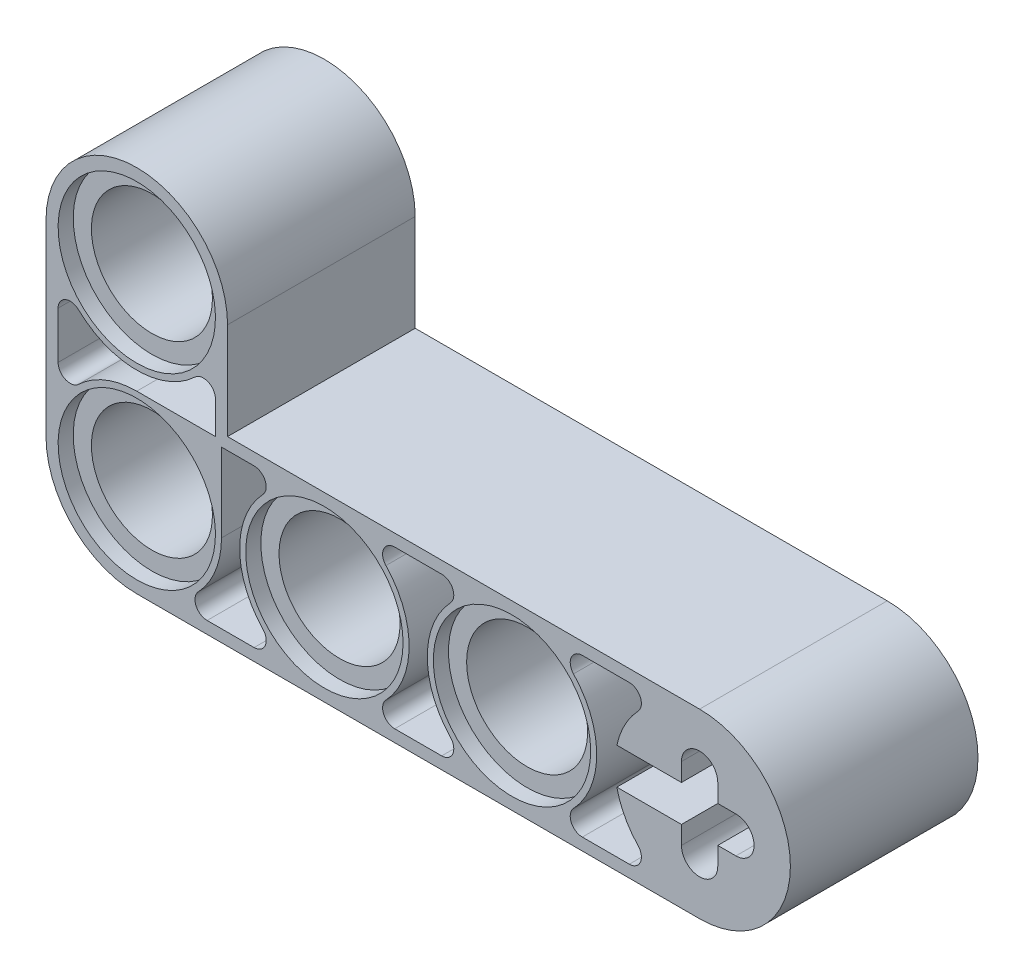
from build123d import *
from build123d.topology import SkipClean

# Parameters (mm, degrees)
LTEMPLATE_START              = -6.034740769
LTEMPLATE_OUTLINE_R          = 2.54
LTEMPLATE_DEPTH              = 6.35
LTEMPLATE_START_2            = -6.669740769
LTEMPLATE_2_OUTLINE_R        = 3.302
LTEMPLATE_2_DEPTH            = 7.62
TWOSTRAIGHT_START            = 0.352935157
TWOSTRAIGHT_OUTLINE_R        = 2.54
TWOSTRAIGHT_DEPTH            = 6.604
TWOSTRAIGHT_START_2          = -0.282064843
TWOSTRAIGHT_2_OUTLINE_R      = 3.302
TWOSTRAIGHT_2_DEPTH          = 7.874
BOSS_EXTRUDE1_DEPTH          = 7.874
BODY_MOVE_COPY18_START       = 1.204259231
BODY_MOVE_COPY18_OUTLINE_R   = 2.54
BODY_MOVE_COPY18_DEPTH       = 6.387675926
BODY_MOVE_COPY18_START_2     = -0.282064843
BODY_MOVE_COPY18_2_OUTLINE_R = 2.54
BODY_MOVE_COPY18_2_DEPTH     = 1.486324074
BODY_MOVE_COPY18_START_3     = 0.569259231
BODY_MOVE_COPY18_3_DEPTH     = 0.635
BODY_MOVE_COPY18_START_4     = -6.034740769
BODY_MOVE_COPY18_4_OUTLINE_R = 2.54
BODY_MOVE_COPY18_4_DEPTH     = 6.604
BODY_MOVE_COPY18_START_5     = -6.669740769
BODY_MOVE_COPY18_5_OUTLINE_R = 3.302
BODY_MOVE_COPY18_5_DEPTH     = 7.874
CUT_EXTRUDE3_DEPTH           = 7.874
CUT_EXTRUDE5_DEPTH           = 7.874
BOSS_EXTRUDE3_DEPTH          = 7.874


# Read off the part's stored shape, not the designer's step: LTemplate, TwoStraight, Body-Move/Copy18
with BuildPart() as part:
    # LTemplate outline → LTemplate (new body)
    with BuildSketch(Plane.XY.offset(LTEMPLATE_START)):
        with BuildLine():
            ThreePointArc((-0.233632913, 12.025918555), (-4.043632913, 8.215918555), (-0.233632913, 4.405918555))
            Line((-0.233632913, 4.405918555), (15.514367087, 4.405918555))
            ThreePointArc((15.514367087, 4.405918555), (19.324367087, 8.215918555), (15.514367087, 12.025918555))
            Line((15.514367087, 12.025918555), (-0.233632913, 12.025918555))
        make_face()
        with BuildLine():
            Line((4.689153777, 4.913918555), (2.717580397, 4.913918555))
            ThreePointArc((2.717580397, 4.913918555), (2.250952601, 5.221113923), (2.348678733, 5.771168555))
            ThreePointArc((2.348678733, 5.771168555), (3.322367087, 8.215918555), (2.348678733, 10.660668555))
            ThreePointArc((2.348678733, 10.660668555), (2.250952601, 11.210723186), (2.717580397, 11.517918555))
            Line((2.717580397, 11.517918555), (4.689153777, 11.517918555))
            ThreePointArc((4.689153777, 11.517918555), (5.155781573, 11.210723186), (5.058055441, 10.660668555))
            ThreePointArc((5.058055441, 10.660668555), (4.084367087, 8.215918555), (5.058055441, 5.771168555))
            ThreePointArc((5.058055441, 5.771168555), (5.155781573, 5.221113923), (4.689153777, 4.913918555))
        make_face(mode=Mode.SUBTRACT)
        with BuildLine():
            Line((12.040969327, 8.977918555), (14.752367087, 8.977918555))
            Line((14.752367087, 8.977918555), (14.752367087, 9.739918555))
            ThreePointArc((14.752367087, 9.739918555), (15.514367087, 10.501918555), (16.276367087, 9.739918555))
            Line((16.276367087, 9.739918555), (16.276367087, 8.977918555))
            Line((16.276367087, 8.977918555), (17.038367087, 8.977918555))
            ThreePointArc((17.038367087, 8.977918555), (17.800367087, 8.215918555), (17.038367087, 7.453918555))
            Line((17.038367087, 7.453918555), (16.276367087, 7.453918555))
            Line((16.276367087, 7.453918555), (16.276367087, 6.691918555))
            ThreePointArc((16.276367087, 6.691918555), (15.514367087, 5.929918555), (14.752367087, 6.691918555))
            Line((14.752367087, 6.691918555), (14.752367087, 7.453918555))
            Line((14.752367087, 7.453918555), (12.040969327, 7.453918555))
            ThreePointArc((12.040969327, 7.453918555), (12.371785983, 6.551791154), (12.932055441, 5.771168555))
            ThreePointArc((12.932055441, 5.771168555), (13.029781573, 5.221113923), (12.563153777, 4.913918555))
            Line((12.563153777, 4.913918555), (10.591580397, 4.913918555))
            ThreePointArc((10.591580397, 4.913918555), (10.124952601, 5.221113923), (10.222678733, 5.771168555))
            ThreePointArc((10.222678733, 5.771168555), (11.196367087, 8.215918555), (10.222678733, 10.660668555))
            ThreePointArc((10.222678733, 10.660668555), (10.124952601, 11.210723186), (10.591580397, 11.517918555))
            Line((10.591580397, 11.517918555), (12.563153777, 11.517918555))
            ThreePointArc((12.563153777, 11.517918555), (13.029781573, 11.210723186), (12.932055441, 10.660668555))
            ThreePointArc((12.932055441, 10.660668555), (12.371785983, 9.880045956), (12.040969327, 8.977918555))
        make_face(mode=Mode.SUBTRACT)
        with Locations((-0.233632913, 8.215918555)):
            Circle(LTEMPLATE_OUTLINE_R, mode=Mode.SUBTRACT)
        with Locations((7.640367087, 8.215918555)):
            Circle(LTEMPLATE_OUTLINE_R, mode=Mode.SUBTRACT)
    extrude(amount=LTEMPLATE_DEPTH)

    # LTemplate 2 outline → LTemplate 2 (add)
    with BuildSketch(Plane.XY.offset(LTEMPLATE_START_2)):
        with BuildLine():
            ThreePointArc((-0.233632913, 12.025918555), (-4.043632913, 8.215918555), (-0.233632913, 4.405918555))
            Line((-0.233632913, 4.405918555), (15.514367087, 4.405918555))
            ThreePointArc((15.514367087, 4.405918555), (19.324367087, 8.215918555), (15.514367087, 12.025918555))
            Line((15.514367087, 12.025918555), (-0.233632913, 12.025918555))
        make_face()
        with Locations((-0.233632913, 8.215918555)):
            Circle(LTEMPLATE_2_OUTLINE_R, mode=Mode.SUBTRACT)
        with BuildLine():
            Line((4.689153777, 4.913918555), (2.717580397, 4.913918555))
            ThreePointArc((2.717580397, 4.913918555), (2.250952601, 5.221113923), (2.348678733, 5.771168555))
            ThreePointArc((2.348678733, 5.771168555), (3.322367087, 8.215918555), (2.348678733, 10.660668555))
            ThreePointArc((2.348678733, 10.660668555), (2.250952601, 11.210723186), (2.717580397, 11.517918555))
            Line((2.717580397, 11.517918555), (4.689153777, 11.517918555))
            ThreePointArc((4.689153777, 11.517918555), (5.155781573, 11.210723186), (5.058055441, 10.660668555))
            ThreePointArc((5.058055441, 10.660668555), (4.084367087, 8.215918555), (5.058055441, 5.771168555))
            ThreePointArc((5.058055441, 5.771168555), (5.155781573, 5.221113923), (4.689153777, 4.913918555))
        make_face(mode=Mode.SUBTRACT)
        with Locations((7.640367087, 8.215918555)):
            Circle(LTEMPLATE_2_OUTLINE_R, mode=Mode.SUBTRACT)
        with BuildLine():
            Line((12.040969327, 8.977918555), (14.752367087, 8.977918555))
            Line((14.752367087, 8.977918555), (14.752367087, 9.739918555))
            ThreePointArc((14.752367087, 9.739918555), (15.514367087, 10.501918555), (16.276367087, 9.739918555))
            Line((16.276367087, 9.739918555), (16.276367087, 8.977918555))
            Line((16.276367087, 8.977918555), (17.038367087, 8.977918555))
            ThreePointArc((17.038367087, 8.977918555), (17.800367087, 8.215918555), (17.038367087, 7.453918555))
            Line((17.038367087, 7.453918555), (16.276367087, 7.453918555))
            Line((16.276367087, 7.453918555), (16.276367087, 6.691918555))
            ThreePointArc((16.276367087, 6.691918555), (15.514367087, 5.929918555), (14.752367087, 6.691918555))
            Line((14.752367087, 6.691918555), (14.752367087, 7.453918555))
            Line((14.752367087, 7.453918555), (12.040969327, 7.453918555))
            ThreePointArc((12.040969327, 7.453918555), (12.371785983, 6.551791154), (12.932055441, 5.771168555))
            ThreePointArc((12.932055441, 5.771168555), (13.029781573, 5.221113923), (12.563153777, 4.913918555))
            Line((12.563153777, 4.913918555), (10.591580397, 4.913918555))
            ThreePointArc((10.591580397, 4.913918555), (10.124952601, 5.221113923), (10.222678733, 5.771168555))
            ThreePointArc((10.222678733, 5.771168555), (11.196367087, 8.215918555), (10.222678733, 10.660668555))
            ThreePointArc((10.222678733, 10.660668555), (10.124952601, 11.210723186), (10.591580397, 11.517918555))
            Line((10.591580397, 11.517918555), (12.563153777, 11.517918555))
            ThreePointArc((12.563153777, 11.517918555), (13.029781573, 11.210723186), (12.932055441, 10.660668555))
            ThreePointArc((12.932055441, 10.660668555), (12.371785983, 9.880045956), (12.040969327, 8.977918555))
        make_face(mode=Mode.SUBTRACT)
    extrude(amount=LTEMPLATE_2_DEPTH)


with BuildPart() as body_2:
    # Body-Move/Copy15: copy of part
    add(part.part.moved(Location((0, 0, 0.254))))

    # Combine1: union part
    add(part.part)

    # Sketch1 → Boss-Extrude1 (add)
    with BuildSketch(Plane(origin=(0, 0, -6.669740769), x_dir=(-1, 0, 0), z_dir=(0, 0, -1))):
        with BuildLine():
            Line((8.107632913, 12.025918555), (0.233632913, 12.025918555))
            Line((0.233632913, 12.025918555), (0.233632913, 11.517918555))
            ThreePointArc((0.233632913, 11.517918555), (3.535632913, 8.215918555), (0.233632913, 4.913918555))
            Line((0.233632913, 4.913918555), (0.233632913, 4.405918555))
            Line((0.233632913, 4.405918555), (8.107632913, 4.405918555))
            ThreePointArc((8.107632913, 4.405918555), (4.297632913, 8.215918555), (8.107632913, 12.025918555))
        make_face()
    extrude(amount=-BOSS_EXTRUDE1_DEPTH)


with BuildPart() as body_2_2:
    # TwoStraight outline → TwoStraight (new body)
    with BuildSketch(Plane.XY.offset(TWOSTRAIGHT_START)):
        with BuildLine():
            ThreePointArc((-7.731255998, 20.304824752), (-11.541255998, 16.494824752), (-7.731255998, 12.684824752))
            Line((-7.731255998, 12.684824752), (0.142744002, 12.684824752))
            ThreePointArc((0.142744002, 12.684824752), (3.952744002, 16.494824752), (0.142744002, 20.304824752))
            Line((0.142744002, 20.304824752), (-7.731255998, 20.304824752))
        make_face()
        with BuildLine():
            Line((-4.780042688, 19.796824752), (-2.808469308, 19.796824752))
            ThreePointArc((-2.808469308, 19.796824752), (-2.341841512, 19.489629383), (-2.439567644, 18.939574752))
            ThreePointArc((-2.439567644, 18.939574752), (-3.413255998, 16.494824752), (-2.439567644, 14.050074752))
            ThreePointArc((-2.439567644, 14.050074752), (-2.341841512, 13.500020121), (-2.808469308, 13.192824752))
            Line((-2.808469308, 13.192824752), (-4.780042688, 13.192824752))
            ThreePointArc((-4.780042688, 13.192824752), (-5.246670484, 13.500020121), (-5.148944352, 14.050074752))
            ThreePointArc((-5.148944352, 14.050074752), (-4.175255998, 16.494824752), (-5.148944352, 18.939574752))
            ThreePointArc((-5.148944352, 18.939574752), (-5.246670484, 19.489629383), (-4.780042688, 19.796824752))
        make_face(mode=Mode.SUBTRACT)
        with Locations((-7.731255998, 16.494824752)):
            Circle(TWOSTRAIGHT_OUTLINE_R, mode=Mode.SUBTRACT)
        with Locations((0.142744002, 16.494824752)):
            Circle(TWOSTRAIGHT_OUTLINE_R, mode=Mode.SUBTRACT)
    extrude(amount=TWOSTRAIGHT_DEPTH)

    # TwoStraight 2 outline → TwoStraight 2 (add)
    with BuildSketch(Plane.XY.offset(TWOSTRAIGHT_START_2)):
        with BuildLine():
            ThreePointArc((-7.731255998, 20.304824752), (-11.541255998, 16.494824752), (-7.731255998, 12.684824752))
            Line((-7.731255998, 12.684824752), (0.142744002, 12.684824752))
            ThreePointArc((0.142744002, 12.684824752), (3.952744002, 16.494824752), (0.142744002, 20.304824752))
            Line((0.142744002, 20.304824752), (-7.731255998, 20.304824752))
        make_face()
        with Locations((-7.731255998, 16.494824752)):
            Circle(TWOSTRAIGHT_2_OUTLINE_R, mode=Mode.SUBTRACT)
        with BuildLine():
            Line((-4.780042688, 19.796824752), (-2.808469308, 19.796824752))
            ThreePointArc((-2.808469308, 19.796824752), (-2.341841512, 19.489629383), (-2.439567644, 18.939574752))
            ThreePointArc((-2.439567644, 18.939574752), (-3.413255998, 16.494824752), (-2.439567644, 14.050074752))
            ThreePointArc((-2.439567644, 14.050074752), (-2.341841512, 13.500020121), (-2.808469308, 13.192824752))
            Line((-2.808469308, 13.192824752), (-4.780042688, 13.192824752))
            ThreePointArc((-4.780042688, 13.192824752), (-5.246670484, 13.500020121), (-5.148944352, 14.050074752))
            ThreePointArc((-5.148944352, 14.050074752), (-4.175255998, 16.494824752), (-5.148944352, 18.939574752))
            ThreePointArc((-5.148944352, 18.939574752), (-5.246670484, 19.489629383), (-4.780042688, 19.796824752))
        make_face(mode=Mode.SUBTRACT)
        with Locations((0.142744002, 16.494824752)):
            Circle(TWOSTRAIGHT_2_OUTLINE_R, mode=Mode.SUBTRACT)
    extrude(amount=TWOSTRAIGHT_2_DEPTH)

    # Body-Move/Copy18 outline → Body-Move/Copy18 (cut)
    with BuildSketch(Plane.XY.offset(BODY_MOVE_COPY18_START)):
        with BuildLine():
            ThreePointArc((0.142744002, 12.684824752), (3.952744002, 16.494824752), (0.142744002, 20.304824752))
            Line((0.142744002, 20.304824752), (-7.731255998, 20.304824752))
            ThreePointArc((-7.731255998, 20.304824752), (-11.541255998, 16.494824752), (-7.731255998, 12.684824752))
            Line((-7.731255998, 12.684824752), (0.142744002, 12.684824752))
        make_face()
        with BuildLine():
            ThreePointArc((-5.148944352, 14.050074752), (-4.175255998, 16.494824752), (-5.148944352, 18.939574752))
            ThreePointArc((-5.148944352, 18.939574752), (-5.246670484, 19.489629383), (-4.780042688, 19.796824752))
            Line((-4.780042688, 19.796824752), (-2.808469308, 19.796824752))
            ThreePointArc((-2.808469308, 19.796824752), (-2.341841512, 19.489629383), (-2.439567644, 18.939574752))
            ThreePointArc((-2.439567644, 18.939574752), (-3.413255998, 16.494824752), (-2.439567644, 14.050074752))
            ThreePointArc((-2.439567644, 14.050074752), (-2.341841512, 13.500020121), (-2.808469308, 13.192824752))
            Line((-2.808469308, 13.192824752), (-4.780042688, 13.192824752))
            ThreePointArc((-4.780042688, 13.192824752), (-5.246670484, 13.500020121), (-5.148944352, 14.050074752))
        make_face(mode=Mode.SUBTRACT)
        with Locations((-7.731255998, 16.494824752)):
            Circle(BODY_MOVE_COPY18_OUTLINE_R, mode=Mode.SUBTRACT)
        with Locations((0.142744002, 16.494824752)):
            Circle(BODY_MOVE_COPY18_OUTLINE_R, mode=Mode.SUBTRACT)
    extrude(amount=BODY_MOVE_COPY18_DEPTH, mode=Mode.SUBTRACT)

    # Body-Move_Copy18 2 outline → Body-Move_Copy18 2 (cut)
    # profile 1 of 3: a face of its own
    with BuildSketch(Plane.XY.offset(BODY_MOVE_COPY18_START_2)):
        with BuildLine():
            Line((-7.082707456, 12.684824752), (-4.805632913, 12.684824752))
            Line((-4.805632913, 12.684824752), (-4.805632913, 13.138705245))
            ThreePointArc((-4.805632913, 13.138705245), (-4.806377911, 13.166207289), (-4.808610718, 13.193628668))
            ThreePointArc((-4.808610718, 13.193628668), (-5.12978155, 13.332386524), (-5.285064883, 13.645901329))
            ThreePointArc((-5.285064883, 13.645901329), (-5.4882484, 13.615751817), (-5.662882913, 13.507606909))
            ThreePointArc((-5.662882913, 13.507606909), (-6.324684634, 13.013194415), (-7.082707456, 12.684824752))
        make_face()
    # profile 2 of 3: a face of its own
    with BuildSketch(Plane.XY.offset(BODY_MOVE_COPY18_START_2)):
        with BuildLine():
            Line((-4.297632913, 13.192824752), (-4.297632913, 12.684824752))
            Line((-4.297632913, 12.684824752), (0.142744002, 12.684824752))
            ThreePointArc((0.142744002, 12.684824752), (3.952744002, 16.494824752), (0.142744002, 20.304824752))
            Line((0.142744002, 20.304824752), (-7.731255998, 20.304824752))
            ThreePointArc((-7.731255998, 20.304824752), (-9.379051287, 19.93006429), (-10.702684622, 18.879507526))
            ThreePointArc((-10.702684622, 18.879507526), (-6.586292552, 19.583000791), (-4.297632913, 16.089918555))
            Line((-4.297632913, 16.089918555), (-4.297632913, 15.569963406))
            ThreePointArc((-4.297632913, 15.569963406), (-4.283584635, 17.365857571), (-5.148944352, 18.939574752))
            ThreePointArc((-5.148944352, 18.939574752), (-5.246670484, 19.489629383), (-4.780042688, 19.796824752))
            Line((-4.780042688, 19.796824752), (-2.808469308, 19.796824752))
            ThreePointArc((-2.808469308, 19.796824752), (-2.341841512, 19.489629383), (-2.439567644, 18.939574752))
            ThreePointArc((-2.439567644, 18.939574752), (-3.413255998, 16.494824752), (-2.439567644, 14.050074752))
            ThreePointArc((-2.439567644, 14.050074752), (-2.341841512, 13.500020121), (-2.808469308, 13.192824752))
            Line((-2.808469308, 13.192824752), (-4.297632913, 13.192824752))
        make_face()
        with Locations((0.142744002, 16.494824752)):
            Circle(BODY_MOVE_COPY18_2_OUTLINE_R, mode=Mode.SUBTRACT)
    # profile 3 of 3: a face of its own
    with BuildSketch(Plane.XY.offset(BODY_MOVE_COPY18_START_2)):
        with BuildLine():
            ThreePointArc((-6.070097213, 14.573327551), (-9.460570174, 14.634428966), (-9.768791698, 18.011415756))
            ThreePointArc((-9.768791698, 18.011415756), (-9.836947089, 14.229522769), (-6.070097213, 14.573327551))
        make_face()
    extrude(amount=BODY_MOVE_COPY18_2_DEPTH, mode=Mode.SUBTRACT)

    # Body-Move_Copy18 3 outline → Body-Move_Copy18 3 (cut)
    with BuildSketch(Plane.XY.offset(BODY_MOVE_COPY18_START_3)):
        with BuildLine():
            ThreePointArc((-11.168403989, 14.85101403), (-10.325227262, 13.704231073), (-9.120001735, 12.946940132))
            ThreePointArc((-9.120001735, 12.946940132), (-5.859524484, 18.508433077), (-11.168403989, 14.85101403))
        make_face()
        with BuildLine():
            ThreePointArc((-9.768791698, 18.011415756), (-6.001941822, 18.355220538), (-6.070097213, 14.573327551))
            ThreePointArc((-6.070097213, 14.573327551), (-9.836947089, 14.229522769), (-9.768791698, 18.011415756))
        make_face(mode=Mode.SUBTRACT)
    extrude(amount=BODY_MOVE_COPY18_3_DEPTH, mode=Mode.SUBTRACT)

    # Body-Move_Copy18 4 outline → Body-Move_Copy18 4 (add)
    with SkipClean():  # the faces are left unmerged after this step: merging them gives an invalid solid
        with BuildSketch(Plane.XY.offset(BODY_MOVE_COPY18_START_4)):
            with BuildLine():
                Line((-4.297632913, 8.215918555), (-4.297632913, 16.089918555))
                ThreePointArc((-4.297632913, 16.089918555), (-8.107632913, 19.899918555), (-11.917632913, 16.089918555))
                Line((-11.917632913, 16.089918555), (-11.917632913, 8.215918555))
                ThreePointArc((-11.917632913, 8.215918555), (-8.107632913, 4.405918555), (-4.297632913, 8.215918555))
            make_face()
            with BuildLine():
                ThreePointArc((-4.805632913, 11.167131865), (-5.112828282, 10.700504069), (-5.662882913, 10.798230201))
                ThreePointArc((-5.662882913, 10.798230201), (-8.107632913, 11.771918555), (-10.552382913, 10.798230201))
                ThreePointArc((-10.552382913, 10.798230201), (-11.102437545, 10.700504069), (-11.409632913, 11.167131865))
                Line((-11.409632913, 11.167131865), (-11.409632913, 13.138705245))
                ThreePointArc((-11.409632913, 13.138705245), (-11.102437545, 13.605333041), (-10.552382913, 13.507606909))
                ThreePointArc((-10.552382913, 13.507606909), (-8.107632913, 12.533918555), (-5.662882913, 13.507606909))
                ThreePointArc((-5.662882913, 13.507606909), (-5.112828282, 13.605333041), (-4.805632913, 13.138705245))
                Line((-4.805632913, 13.138705245), (-4.805632913, 11.167131865))
            make_face(mode=Mode.SUBTRACT)
            with Locations((-8.107632913, 8.215918555)):
                Circle(BODY_MOVE_COPY18_4_OUTLINE_R, mode=Mode.SUBTRACT)
            with Locations((-8.107632913, 16.089918555)):
                Circle(BODY_MOVE_COPY18_4_OUTLINE_R, mode=Mode.SUBTRACT)
        extrude(amount=BODY_MOVE_COPY18_4_DEPTH)
    add(body_2_2.part.scale(1), mode=Mode.REPLACE)  # the faces are merged on a copy

    # Body-Move_Copy18 5 outline → Body-Move_Copy18 5 (add)
    with SkipClean():  # the faces are left unmerged after this step: merging them gives an invalid solid
        with BuildSketch(Plane.XY.offset(BODY_MOVE_COPY18_START_5)):
            with BuildLine():
                Line((-4.297632913, 8.215918555), (-4.297632913, 16.089918555))
                ThreePointArc((-4.297632913, 16.089918555), (-8.107632913, 19.899918555), (-11.917632913, 16.089918555))
                Line((-11.917632913, 16.089918555), (-11.917632913, 8.215918555))
                ThreePointArc((-11.917632913, 8.215918555), (-8.107632913, 4.405918555), (-4.297632913, 8.215918555))
            make_face()
            with BuildLine():
                ThreePointArc((-4.805632913, 11.167131865), (-5.112828282, 10.700504069), (-5.662882913, 10.798230201))
                ThreePointArc((-5.662882913, 10.798230201), (-8.107632913, 11.771918555), (-10.552382913, 10.798230201))
                ThreePointArc((-10.552382913, 10.798230201), (-11.102437545, 10.700504069), (-11.409632913, 11.167131865))
                Line((-11.409632913, 11.167131865), (-11.409632913, 13.138705245))
                ThreePointArc((-11.409632913, 13.138705245), (-11.102437545, 13.605333041), (-10.552382913, 13.507606909))
                ThreePointArc((-10.552382913, 13.507606909), (-8.107632913, 12.533918555), (-5.662882913, 13.507606909))
                ThreePointArc((-5.662882913, 13.507606909), (-5.112828282, 13.605333041), (-4.805632913, 13.138705245))
                Line((-4.805632913, 13.138705245), (-4.805632913, 11.167131865))
            make_face(mode=Mode.SUBTRACT)
            with Locations((-8.107632913, 16.089918555)):
                Circle(BODY_MOVE_COPY18_5_OUTLINE_R, mode=Mode.SUBTRACT)
            with Locations((-8.107632913, 8.215918555)):
                Circle(BODY_MOVE_COPY18_5_OUTLINE_R, mode=Mode.SUBTRACT)
        extrude(amount=BODY_MOVE_COPY18_5_DEPTH)
    add(body_2_2.part.scale(1), mode=Mode.REPLACE)  # the faces are merged on a copy


with BuildPart() as body_2_1:
    add(body_2.part)

    # Combine2: union body 2 2
    add(body_2_2.part)

    # Sketch4 → Cut-Extrude3 (cut)
    with BuildSketch(Plane(origin=(0, 0, -6.669740769), x_dir=(-1, 0, 0), z_dir=(0, 0, -1))):
        with BuildLine():
            Line((3.184846223, 4.913918555), (5.156419603, 4.913918555))
            ThreePointArc((5.156419603, 4.913918555), (5.623047399, 5.221113923), (5.525321267, 5.771168555))
            ThreePointArc((5.525321267, 5.771168555), (4.804010945, 6.900161019), (4.551632913, 8.215918555))
            Line((4.551632913, 8.215918555), (4.551632913, 11.517918555))
            Line((4.551632913, 11.517918555), (3.184846223, 11.517918555))
            ThreePointArc((3.184846223, 11.517918555), (2.718218427, 11.210723186), (2.815944559, 10.660668555))
            ThreePointArc((2.815944559, 10.660668555), (3.789632913, 8.215918555), (2.815944559, 5.771168555))
            ThreePointArc((2.815944559, 5.771168555), (2.718218427, 5.221113923), (3.184846223, 4.913918555))
        make_face()
    extrude(amount=-CUT_EXTRUDE3_DEPTH, mode=Mode.SUBTRACT)

    # Sketch6 → Cut-Extrude5 (cut)
    with BuildSketch(Plane(origin=(0, 0, -6.669740769), x_dir=(-1, 0, 0), z_dir=(0, 0, -1))):
        with BuildLine():
            Line((11.409632913, 13.138705245), (11.409632913, 11.167131865))
            ThreePointArc((11.409632913, 11.167131865), (11.102437545, 10.700504069), (10.552382913, 10.798230201))
            ThreePointArc((10.552382913, 10.798230201), (9.423390449, 11.519540523), (8.107632913, 11.771918555))
            Line((8.107632913, 11.771918555), (4.805632913, 11.771918555))
            Line((4.805632913, 11.771918555), (4.805632913, 13.138705245))
            ThreePointArc((4.805632913, 13.138705245), (5.112828282, 13.605333041), (5.662882913, 13.507606909))
            ThreePointArc((5.662882913, 13.507606909), (8.107632913, 12.533918555), (10.552382913, 13.507606909))
            ThreePointArc((10.552382913, 13.507606909), (11.102437545, 13.605333041), (11.409632913, 13.138705245))
        make_face()
    extrude(amount=-CUT_EXTRUDE5_DEPTH, mode=Mode.SUBTRACT)

    # Sketch8 → Boss-Extrude3 (add)
    with BuildSketch(Plane(origin=(0, 0, -6.669740769), x_dir=(-1, 0, 0), z_dir=(0, 0, -1))):
        with BuildLine():
            Line((4.805632913, 11.771918555), (8.107632913, 11.771918555))
            ThreePointArc((8.107632913, 11.771918555), (6.109495376, 11.157445774), (4.801909655, 9.526387836))
            Line((4.801909655, 9.526387836), (4.805632913, 11.771918555))
        make_face()
    extrude(amount=-BOSS_EXTRUDE3_DEPTH)


solid = body_2_1.part
